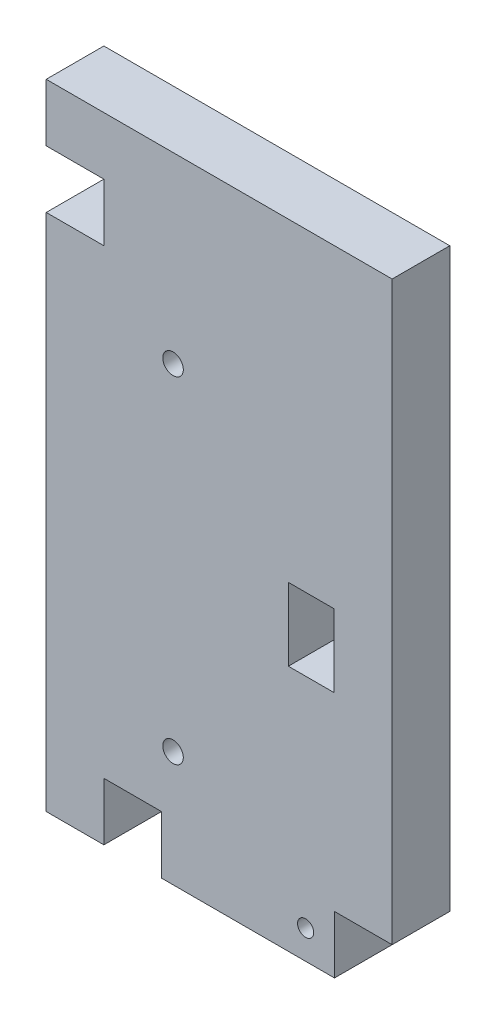
from build123d import *

# Parameters (mm, degrees)
SKETCH1_R           = 1.1303
SKETCH1_R_2         = 0.889
SKETCH1_W           = 5
SKETCH1_H           = 8
BOSS_EXTRUDE1_DEPTH = 6.35


with BuildPart() as part:
    # Sketch1 → Boss-Extrude1 (new body)
    with BuildSketch(Plane.XY):
        Polygon((-16.134535362, 9.317270845), (-16.134535362, -47.832729155), (-9.784535362, -47.832729155), (-9.784535362, -41.482729155), (-3.434535362, -41.482729155), (-3.434535362, -47.832729155), (15.615464638, -47.832729155), (15.615464638, -41.482729155), (21.965464638, -41.482729155), (21.965464638, 22.017270845), (-16.134535362, 22.017270845), (-16.134535362, 15.667270845), (-9.784535362, 15.667270845), (-9.784535362, 9.317270845), align=None)
        with Locations((-2.164535362, -35.132729155)):
            Circle(SKETCH1_R, mode=Mode.SUBTRACT)
        with Locations((-2.164535362, 1.867270845)):
            Circle(SKETCH1_R, mode=Mode.SUBTRACT)
        with Locations((12.440464638, -44.657729155)):
            Circle(SKETCH1_R_2, mode=Mode.SUBTRACT)
        with Locations((13.035464638, -16.632729079)):
            Rectangle(SKETCH1_W, SKETCH1_H, mode=Mode.SUBTRACT)
    extrude(amount=BOSS_EXTRUDE1_DEPTH)


solid = part.part
